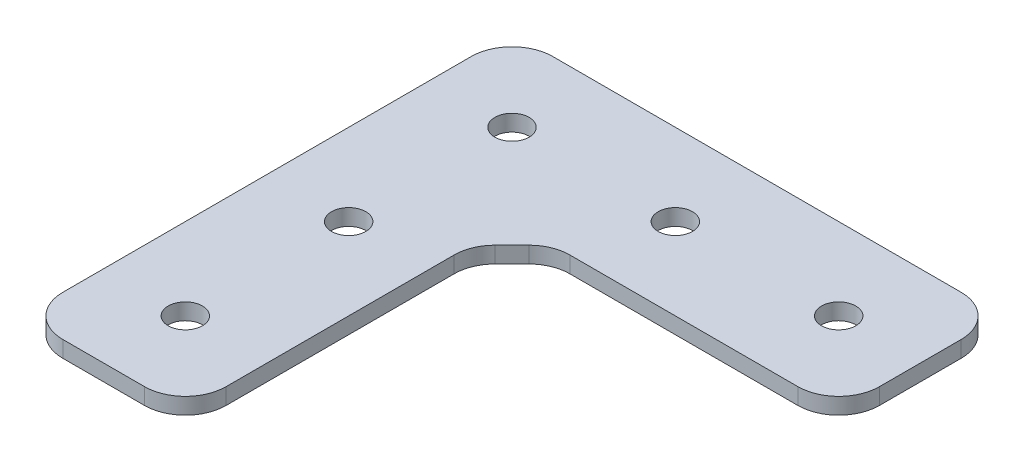
from build123d import *

# Parameters (mm, degrees)
SKETCH1_R          = 2.1
BASE_FLANGE1_DEPTH = 2
FILLET_SHAPE_R     = 5
CHAMFER2_SIZE      = 5
FILLET2_R          = 5


# Sheet-metal steps are written as plain solids
with BuildPart() as part:
    # Sketch1 → Base-Flange1 (new body)
    with BuildSketch(Plane(origin=(0, 0, 0), x_dir=(1, 0, 0), z_dir=(0, 1, 0))):
        Polygon((-10, 10), (50, 10), (50, -10), (10, -10), (10, -50), (-10, -50), align=None)
        with Locations(Location((0, 0, 0), (0, 0, 270))):
            Circle(SKETCH1_R, mode=Mode.SUBTRACT)
        with Locations(Location((20, 0, 0), (0, 0, 270))):
            Circle(SKETCH1_R, mode=Mode.SUBTRACT)
        with Locations(Location((40, 0, 0), (0, 0, 270))):
            Circle(SKETCH1_R, mode=Mode.SUBTRACT)
        with Locations(Location((0, -20, 0), (0, 0, 270))):
            Circle(SKETCH1_R, mode=Mode.SUBTRACT)
        with Locations(Location((0, -40, 0), (0, 0, 270))):
            Circle(SKETCH1_R, mode=Mode.SUBTRACT)
    extrude(amount=-BASE_FLANGE1_DEPTH)

    # Fillet_Shape
    fillet_shape_edges = [part.edges().sort_by_distance(p)[0] for p in [
        (10, -1, 50),
        (-10, -1, 50),
        (-10, -1, -10),
        (50, -1, -10),
        (50, -1, 10),
    ]]
    fillet(fillet_shape_edges, radius=FILLET_SHAPE_R)

    # Chamfer2
    chamfer2_edges = [part.edges().sort_by_distance(p)[0] for p in [
        (10, -1, 10),
    ]]
    chamfer(chamfer2_edges, length=CHAMFER2_SIZE)

    # Fillet2
    fillet2_edges = [part.edges().sort_by_distance(p)[0] for p in [
        (10, -1, 15),
        (15, -1, 10),
    ]]
    fillet(fillet2_edges, radius=FILLET2_R)


solid = part.part
